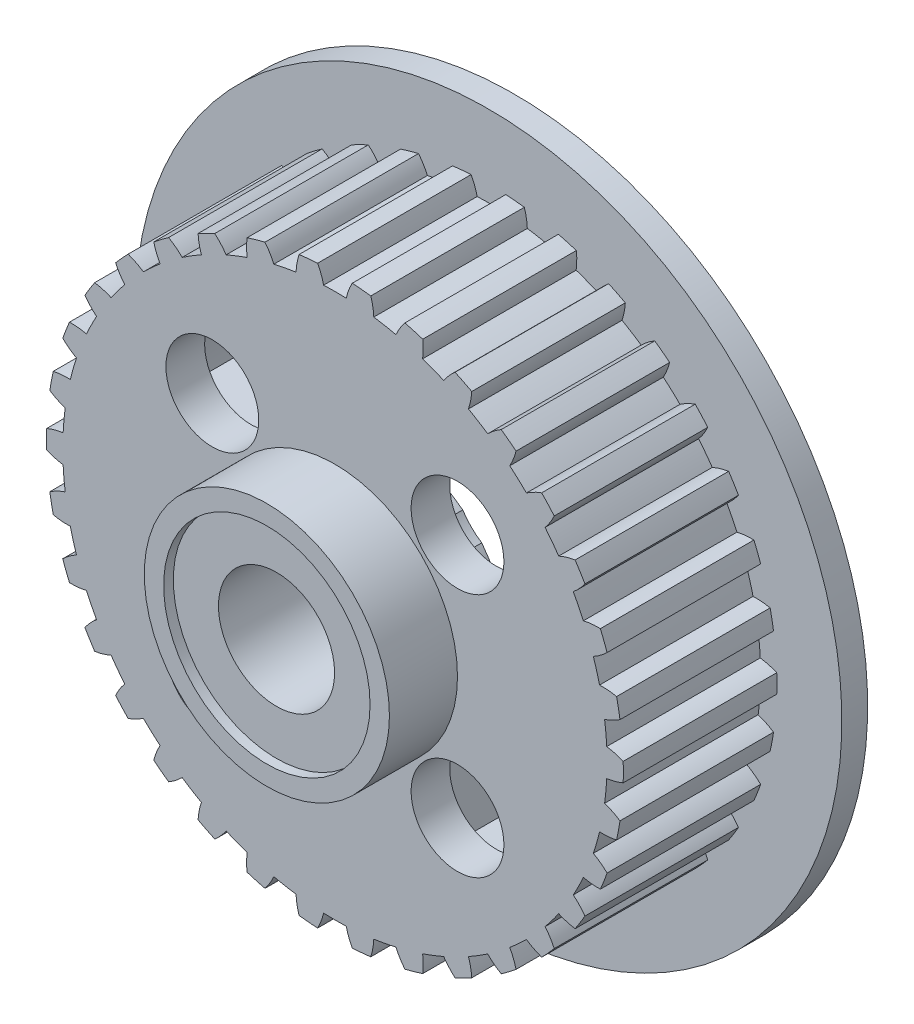
from build123d import *

# Parameters (mm, degrees)
SKETCH2_R           = 44.705
SKETCH2_R_2         = 42.18
BOSS_EXTRUDE1_DEPTH = 23.8
CUT_EXTRUDE4_DEPTH  = 68.553786348
CIRPATTERN1_COUNT   = 34
SKETCH5_R           = 54.78
BOSS_EXTRUDE2_DEPTH = 4
SKETCH6_R           = 39.44
CUT_EXTRUDE5_DEPTH  = 20.8
SKETCH7_R           = 19
SKETCH7_R_2         = 16
BOSS_EXTRUDE3_DEPTH = 10.55
SKETCH8_R           = 9
CUT_EXTRUDE7_DEPTH  = 87.443156467
SKETCH11_R          = 16
CUT_EXTRUDE8_DEPTH  = 1.5
SKETCH12_R          = 7.195
CUT_EXTRUDE9_DEPTH  = 81.214317924
SKETCH14_R          = 9.72
CUT_EXTRUDE10_DEPTH = 1
CIRPATTERN2_COUNT   = 4
BOSS_EXTRUDE4_DEPTH = 2
SKETCH16_R          = 9
CUT_EXTRUDE11_DEPTH = 80.899307256
SKETCH17_R          = 13.58
BOSS_EXTRUDE5_DEPTH = 1
SKETCH18_R          = 9
CUT_EXTRUDE12_DEPTH = 81.149855271
SKETCH19_W          = 26.949683737
SKETCH19_H          = 3.429167546
BOSS_EXTRUDE6_DEPTH = 16.8
CIRPATTERN5_COUNT   = 4


with BuildPart() as part:
    # Sketch2 → Boss-Extrude1 (new body)
    # profile 1 of 2: a face of its own
    with BuildSketch(Plane.XY):
        Circle(SKETCH2_R)
        Circle(SKETCH2_R_2, mode=Mode.SUBTRACT)
    # profile 2 of 2: a face of its own
    with BuildSketch(Plane.XY):
        Circle(SKETCH2_R_2)
    extrude(amount=BOSS_EXTRUDE1_DEPTH)

    # Sketch3 → Cut-Extrude4 (cut, symmetric)
    with BuildSketch(Plane.XY):
        with BuildLine():
            ThreePointArc((-1.75, 42.143681614), (0, 42.18), (1.75, 42.143681614))
            ThreePointArc((1.75, 42.143681614), (2.13493513, 43.415109421), (2.685, 44.624296073))
            ThreePointArc((2.685, 44.624296073), (0, 44.705), (-2.685, 44.624296073))
            ThreePointArc((-2.685, 44.624296073), (-2.13493513, 43.415109421), (-1.75, 42.143681614))
        make_face()
    cut_extrude4 = extrude(amount=CUT_EXTRUDE4_DEPTH, both=True, mode=Mode.SUBTRACT)

    # CirPattern1: Cut-Extrude4 ×34 about axis
    cirpattern1_axis = Axis((0, 0, 0), (0, 0, 1))
    for i in range(1, CIRPATTERN1_COUNT):
        add(cut_extrude4.rotate(cirpattern1_axis, i * 360 / CIRPATTERN1_COUNT), mode=Mode.SUBTRACT)

    # Sketch5 → Boss-Extrude2 (add)
    with BuildSketch(Plane(origin=(0, 0, 0), x_dir=(-1, 0, 0), z_dir=(0, 0, -1))):
        Circle(SKETCH5_R)
    extrude(amount=BOSS_EXTRUDE2_DEPTH)

    # Sketch6 → Cut-Extrude5 (cut)
    with BuildSketch(Plane(origin=(0, 0, -4), x_dir=(-1, 0, 0), z_dir=(0, 0, -1))):
        Circle(SKETCH6_R)
    extrude(amount=-CUT_EXTRUDE5_DEPTH, mode=Mode.SUBTRACT)

    # Sketch7 → Boss-Extrude3 (add)
    # profile 1 of 2: a face of its own
    with BuildSketch(Plane.XY.offset(23.8)):
        Circle(SKETCH7_R)
        Circle(SKETCH7_R_2, mode=Mode.SUBTRACT)
    # profile 2 of 2: a face of its own
    with BuildSketch(Plane.XY.offset(23.8)):
        Circle(SKETCH7_R_2)
    extrude(amount=BOSS_EXTRUDE3_DEPTH)

    # Sketch8 → Cut-Extrude7 (cut, through all)
    with BuildSketch(Plane.XY.offset(34.35)):
        Circle(SKETCH8_R)
    extrude(amount=-CUT_EXTRUDE7_DEPTH, mode=Mode.SUBTRACT)

    # Sketch11 → Cut-Extrude8 (cut)
    with BuildSketch(Plane.XY.offset(34.35)):
        Circle(SKETCH11_R)
    extrude(amount=-CUT_EXTRUDE8_DEPTH, mode=Mode.SUBTRACT)

    # Sketch12 → Cut-Extrude9 (cut, through all)
    with BuildSketch(Plane(origin=(0, 0, 16.8), x_dir=(-1, 0, 0), z_dir=(0, 0, -1))):
        with Locations((19, 19)):
            Circle(SKETCH12_R)
        with Locations((19, -19)):
            Circle(SKETCH12_R)
        with Locations((-19, -19)):
            Circle(SKETCH12_R)
        with Locations((-19, 19)):
            Circle(SKETCH12_R)
    extrude(amount=-CUT_EXTRUDE9_DEPTH, mode=Mode.SUBTRACT)

    # Sketch14 → Cut-Extrude10 (cut)
    with BuildSketch(Plane(origin=(0, 0, 16.8), x_dir=(-1, 0, 0), z_dir=(0, 0, -1))):
        with Locations((19, 19)):
            Circle(SKETCH14_R)
    cut_extrude10 = extrude(amount=-CUT_EXTRUDE10_DEPTH, mode=Mode.SUBTRACT)

    # CirPattern2: Cut-Extrude10 ×4 about axis
    cirpattern2_axis = Axis((0, 0, 0), (0, 0, 1))
    for i in range(1, CIRPATTERN2_COUNT):
        add(cut_extrude10.rotate(cirpattern2_axis, i * 360 / CIRPATTERN2_COUNT), mode=Mode.SUBTRACT)

    # Boss-Extrude4: read off the stored shape, not the designer's step
    # Boss-Extrude4 outline → Boss-Extrude4 (add)
    with BuildSketch(Plane(origin=(0, 0, 16.8), x_dir=(-1, 0, 0), z_dir=(0, 0, -1))):
        with BuildLine():
            ThreePointArc((13.758777403, 10.814159439), (12.126922087, 12.126922087), (10.814159439, 13.758777403))
            ThreePointArc((10.814159439, 13.758777403), (0, 17.5), (-10.814159439, 13.758777403))
            ThreePointArc((-10.814159439, 13.758777403), (-12.126922087, 12.126922087), (-13.758777403, 10.814159439))
            ThreePointArc((-13.758777403, 10.814159439), (-17.5, 0), (-13.758777403, -10.814159439))
            ThreePointArc((-13.758777403, -10.814159439), (-12.126922087, -12.126922087), (-10.814159439, -13.758777403))
            ThreePointArc((-10.814159439, -13.758777403), (0, -17.5), (10.814159439, -13.758777403))
            ThreePointArc((10.814159439, -13.758777403), (12.126922087, -12.126922087), (13.758777403, -10.814159439))
            ThreePointArc((13.758777403, -10.814159439), (17.5, 0), (13.758777403, 10.814159439))
        make_face()
    extrude(amount=BOSS_EXTRUDE4_DEPTH)

    # Sketch16 → Cut-Extrude11 (cut, through all)
    with BuildSketch(Plane(origin=(0, 0, 14.8), x_dir=(-1, 0, 0), z_dir=(0, 0, -1))):
        with Locations(Location((0, 0, 0), (0, 0, 180))):
            Circle(SKETCH16_R)
    extrude(amount=-CUT_EXTRUDE11_DEPTH, mode=Mode.SUBTRACT)

    # Sketch17 → Boss-Extrude5 (add)
    with BuildSketch(Plane(origin=(0, 0, 14.8), x_dir=(-1, 0, 0), z_dir=(0, 0, -1))):
        Circle(SKETCH17_R)
    extrude(amount=BOSS_EXTRUDE5_DEPTH)

    # Sketch18 → Cut-Extrude12 (cut, through all)
    with BuildSketch(Plane(origin=(0, 0, 13.8), x_dir=(-1, 0, 0), z_dir=(0, 0, -1))):
        with Locations(Location((0, 0, 0), (0, 0, 180))):
            Circle(SKETCH18_R)
    extrude(amount=-CUT_EXTRUDE12_DEPTH, mode=Mode.SUBTRACT)

    # Sketch19 → Boss-Extrude6 (add)
    with BuildSketch(Plane(origin=(0, 0, 16.8), x_dir=(-1, 0, 0), z_dir=(0, 0, -1))):
        with Locations((26.946167063, 0)):
            Rectangle(SKETCH19_W, SKETCH19_H)
    boss_extrude6 = extrude(amount=BOSS_EXTRUDE6_DEPTH)

    # Chamfer1
    # the kernel refuses this chamfer: 20 mm, written as the material it takes off along each edge
    with BuildSketch(Plane(origin=(-13.471325194, 1.714583773, 0), x_dir=(-1, 0, 0), z_dir=(0, -1, 0))) as chamfer1_piece_1_section:
        with BuildLine():
            Line((20.565685425, 0.565685425), (-0.565685425, -20.565685425))
            Line((-0.565685425, -20.565685425), (-0.965685425, -20.565685425))
            ThreePointArc((-0.965685425, -20.565685425), (-0.4, -10.282842712), (-0.4, 0))
            Line((-0.4, 0), (0, 0.4))
            ThreePointArc((0, 0.4), (10.282842712, 0.4), (20.565685425, 0.965685425))
            Line((20.565685425, 0.965685425), (20.565685425, 0.565685425))
        make_face()
    chamfer1_piece_1 = extrude(amount=3.429167546, mode=Mode.PRIVATE)
    chamfer1_piece_1 = split(chamfer1_piece_1, bisect_by=Plane(origin=(-13.471325194, 1.714583773, 13.8), z_dir=(0, 0, -1)), keep=Keep.TOP, mode=Mode.PRIVATE)
    add(chamfer1_piece_1, mode=Mode.SUBTRACT)

    # CirPattern5: Boss-Extrude6 ×4 about axis
    cirpattern5_axis = Axis((0, 0, 0), (0, 0, 1))
    for i in range(1, CIRPATTERN5_COUNT):
        add(boss_extrude6.rotate(cirpattern5_axis, i * 360 / CIRPATTERN5_COUNT))

    # Chamfer1 of CirPattern5
    # the kernel refuses this chamfer: 20 mm, written as the material it takes off along each edge
    with BuildSketch(Plane(origin=(-1.714583773, -13.471325194, 0), x_dir=(0, -1, 0), z_dir=(1, 0, 0))) as chamfer1_of_cirpattern5_piece_1_section:
        with BuildLine():
            Line((20.565685425, 0.565685425), (-0.565685425, -20.565685425))
            Line((-0.565685425, -20.565685425), (-0.965685425, -20.565685425))
            ThreePointArc((-0.965685425, -20.565685425), (-0.4, -10.282842712), (-0.4, 0))
            Line((-0.4, 0), (0, 0.4))
            ThreePointArc((0, 0.4), (10.282842712, 0.4), (20.565685425, 0.965685425))
            Line((20.565685425, 0.965685425), (20.565685425, 0.565685425))
        make_face()
    chamfer1_of_cirpattern5_piece_1 = extrude(amount=3.429167546, mode=Mode.PRIVATE)
    chamfer1_of_cirpattern5_piece_1 = split(chamfer1_of_cirpattern5_piece_1, bisect_by=Plane(origin=(-1.714583773, -13.471325194, 13.8), z_dir=(0, 0, -1)), keep=Keep.TOP, mode=Mode.PRIVATE)
    add(chamfer1_of_cirpattern5_piece_1, mode=Mode.SUBTRACT)
    with BuildSketch(Plane(origin=(13.471325194, -1.714583773, 0), x_dir=(1, 0, 0), z_dir=(0, 1, 0))) as chamfer1_of_cirpattern5_piece_2_section:
        with BuildLine():
            Line((20.565685425, 0.565685425), (-0.565685425, -20.565685425))
            Line((-0.565685425, -20.565685425), (-0.965685425, -20.565685425))
            ThreePointArc((-0.965685425, -20.565685425), (-0.4, -10.282842712), (-0.4, 0))
            Line((-0.4, 0), (0, 0.4))
            ThreePointArc((0, 0.4), (10.282842712, 0.4), (20.565685425, 0.965685425))
            Line((20.565685425, 0.965685425), (20.565685425, 0.565685425))
        make_face()
    chamfer1_of_cirpattern5_piece_2 = extrude(amount=3.429167546, mode=Mode.PRIVATE)
    chamfer1_of_cirpattern5_piece_2 = split(chamfer1_of_cirpattern5_piece_2, bisect_by=Plane(origin=(13.471325194, -1.714583773, 13.8), z_dir=(0, 0, -1)), keep=Keep.TOP, mode=Mode.PRIVATE)
    add(chamfer1_of_cirpattern5_piece_2, mode=Mode.SUBTRACT)
    with BuildSketch(Plane(origin=(1.714583773, 13.471325194, 0), x_dir=(0, 1, 0), z_dir=(-1, 0, 0))) as chamfer1_of_cirpattern5_piece_3_section:
        with BuildLine():
            Line((20.565685425, 0.565685425), (-0.565685425, -20.565685425))
            Line((-0.565685425, -20.565685425), (-0.965685425, -20.565685425))
            ThreePointArc((-0.965685425, -20.565685425), (-0.4, -10.282842712), (-0.4, 0))
            Line((-0.4, 0), (0, 0.4))
            ThreePointArc((0, 0.4), (10.282842712, 0.4), (20.565685425, 0.965685425))
            Line((20.565685425, 0.965685425), (20.565685425, 0.565685425))
        make_face()
    chamfer1_of_cirpattern5_piece_3 = extrude(amount=3.429167546, mode=Mode.PRIVATE)
    chamfer1_of_cirpattern5_piece_3 = split(chamfer1_of_cirpattern5_piece_3, bisect_by=Plane(origin=(1.714583773, 13.471325194, 13.8), z_dir=(0, 0, -1)), keep=Keep.TOP, mode=Mode.PRIVATE)
    add(chamfer1_of_cirpattern5_piece_3, mode=Mode.SUBTRACT)


solid = part.part
